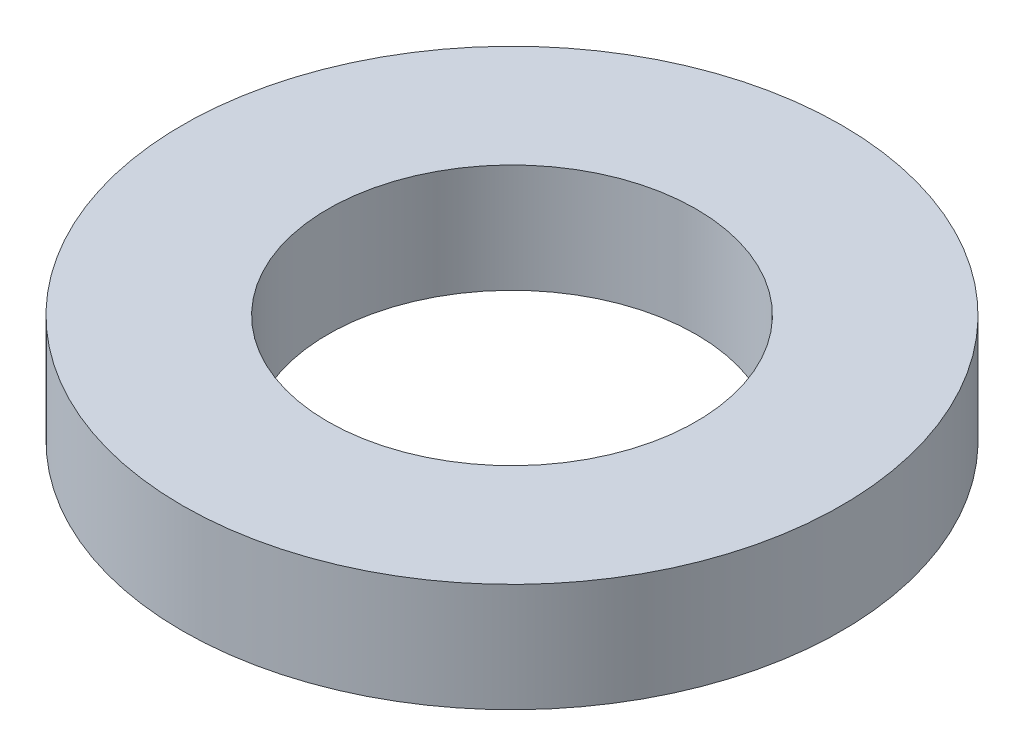
from build123d import *

# Parameters (mm, degrees)
SKETCH1_R           = 85
BOSS_EXTRUDE1_DEPTH = 28
SKETCH2_R           = 47.5
CUT_EXTRUDE1_DEPTH  = 124.426091245


with BuildPart() as part:
    # Sketch1 → Boss-Extrude1 (new body)
    with BuildSketch(Plane(origin=(0, 0, 0), x_dir=(1, 0, 0), z_dir=(0, 1, 0))):
        Circle(SKETCH1_R)
    extrude(amount=BOSS_EXTRUDE1_DEPTH)

    # Sketch2 → Cut-Extrude1 (cut, through all)
    with BuildSketch(Plane(origin=(0, 0, 0), x_dir=(1, 0, 0), z_dir=(0, 1, 0))):
        Circle(SKETCH2_R)
    extrude(amount=CUT_EXTRUDE1_DEPTH, mode=Mode.SUBTRACT)


solid = part.part
